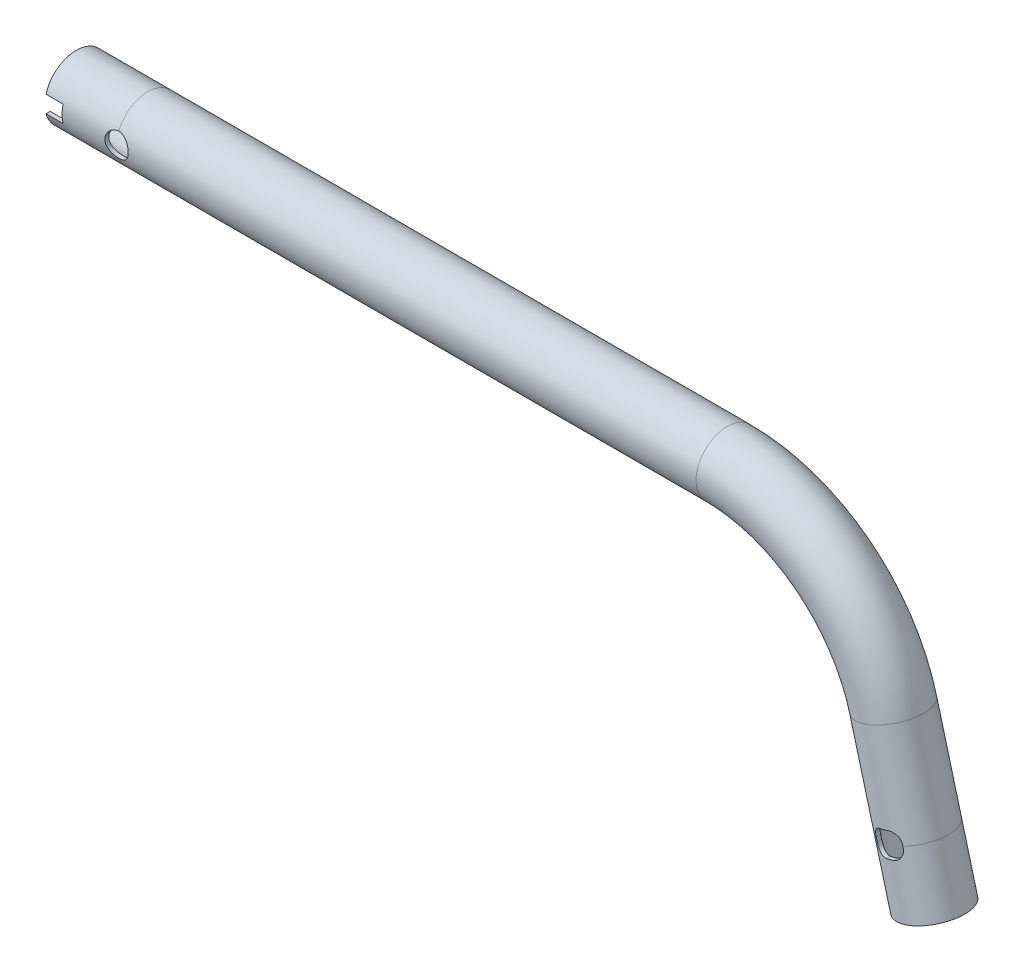
from build123d import *

# Parameters (mm, degrees)
SKETCH2_R                      = 9.5
SKETCH2_R_2                    = 8.3
CUT_EXTRUDE1_REACH             = 264.535
CUT_EXTRUDE1_DIRECTION_2_REACH = 264.535
CUT_EXTRUDE2_REACH             = 264.535
SKETCH4_R                      = 3.55
CUT_EXTRUDE3_DEPTH             = 263.534867109
CUT_EXTRUDE3_DEPTH_BACK        = 263.534867109


with BuildPart() as part:
    # Sweep1: sweep along a path in Sketch1
    with BuildLine(Plane.XY) as sweep1_path:
        Line((-21.7, 0), (0, 0))
        Line((0, 0), (175.503580409, 0))
        ThreePointArc((175.503580409, 0), (207.159174718, -10.745626305), (225.731723376, -38.541409655))
        Line((225.731723376, -38.541409655), (233.25, -66.6))
        Line((233.25, -66.6), (238.180265141, -85))
    # Sketch2 → Sweep1 (sweep)
    with BuildSketch(Plane.ZY.offset(21.7)):
        Circle(SKETCH2_R)
        Circle(SKETCH2_R_2, mode=Mode.SUBTRACT)
    sweep(path=sweep1_path.line)

    # Sketch3 → Cut-Extrude1 (cut, up to next)
    with BuildSketch(Plane.XY, mode=Mode.PRIVATE) as cut_extrude1_sk1:
        with BuildLine():
            Line((233.115347868, -70.347545037), (235.240384686, -69.778143138))
            ThreePointArc((235.240384686, -69.778143138), (237.062003762, -68.380365659), (237.361705029, -66.103908523))
            Line((237.361705029, -66.103908523), (237.058886746, -64.973775307))
            ThreePointArc((237.058886746, -64.973775307), (235.661109268, -63.152156231), (233.384652132, -62.852454963))
            Line((233.384652132, -62.852454963), (231.259615314, -63.421856862))
            ThreePointArc((231.259615314, -63.421856862), (229.437996238, -64.819634341), (229.138294971, -67.096091477))
            Line((229.138294971, -67.096091477), (229.441113254, -68.226224693))
            ThreePointArc((229.441113254, -68.226224693), (230.838890732, -70.047843769), (233.115347868, -70.347545037))
        make_face()
    cut_extrude1_tool1 = extrude(cut_extrude1_sk1.sketch, amount=-CUT_EXTRUDE1_REACH, mode=Mode.PRIVATE) & part.part
    add(cut_extrude1_tool1.solids().sort_by_distance((233.25, -66.6, 0))[0], mode=Mode.SUBTRACT)

    # Sketch3 → Cut-Extrude1 direction 2 (cut, up to next)
    with BuildSketch(Plane.XY, mode=Mode.PRIVATE) as cut_extrude1_direction_2_sk1:
        with BuildLine():
            Line((233.115347868, -70.347545037), (235.240384686, -69.778143138))
            ThreePointArc((235.240384686, -69.778143138), (237.062003762, -68.380365659), (237.361705029, -66.103908523))
            Line((237.361705029, -66.103908523), (237.058886746, -64.973775307))
            ThreePointArc((237.058886746, -64.973775307), (235.661109268, -63.152156231), (233.384652132, -62.852454963))
            Line((233.384652132, -62.852454963), (231.259615314, -63.421856862))
            ThreePointArc((231.259615314, -63.421856862), (229.437996238, -64.819634341), (229.138294971, -67.096091477))
            Line((229.138294971, -67.096091477), (229.441113254, -68.226224693))
            ThreePointArc((229.441113254, -68.226224693), (230.838890732, -70.047843769), (233.115347868, -70.347545037))
        make_face()
    cut_extrude1_direction_2_tool1 = extrude(cut_extrude1_direction_2_sk1.sketch, amount=CUT_EXTRUDE1_DIRECTION_2_REACH, mode=Mode.PRIVATE) & part.part
    add(cut_extrude1_direction_2_tool1.solids().sort_by_distance((233.25, -66.6, 0))[0], mode=Mode.SUBTRACT)

    # Sketch4 → Cut-Extrude2 (cut, up to next)
    with BuildSketch(Plane.XY, mode=Mode.PRIVATE) as cut_extrude2_sk1:
        Circle(SKETCH4_R)
    cut_extrude2_tool1 = extrude(cut_extrude2_sk1.sketch, amount=CUT_EXTRUDE2_REACH, mode=Mode.PRIVATE) & part.part
    add(cut_extrude2_tool1.solids().sort_by_distance((0, 0, 0))[0], mode=Mode.SUBTRACT)

    # Sketch5 → Cut-Extrude3 (cut, two sides: drawn at the far end of the back side and taken through both)
    with BuildSketch(Plane.XY.offset(-CUT_EXTRUDE3_DEPTH_BACK)):
        Polygon((-21.7, 0), (-21.7, 2.555), (-16.5, 2.555), (-16.5, -2.555), (-21.7, -2.555), align=None)
    extrude(amount=CUT_EXTRUDE3_DEPTH + CUT_EXTRUDE3_DEPTH_BACK, mode=Mode.SUBTRACT)


solid = part.part
